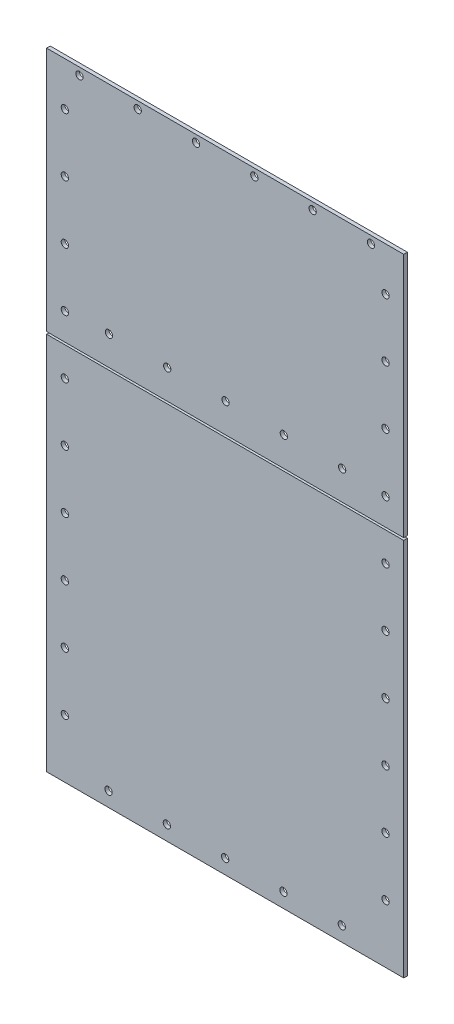
from build123d import *

# Parameters (mm, degrees)
SKETCH1_W             = 155.58
SKETCH1_H             = 106.95
SKETCH1_R             = 1.5875
BOSS_EXTRUDE1_DEPTH   = 1.5875
SKETCH1_H_2           = 165.1
BOSS_EXTRUDE1_2_DEPTH = 1.5875


with BuildPart() as part:
    # Sketch1 → Boss-Extrude1 (new body)
    with BuildSketch(Plane.XY):
        with Locations((77.79, -53.475)):
            Rectangle(SKETCH1_W, SKETCH1_H)
        with Locations((7.94, -95.25)):
            Circle(SKETCH1_R, mode=Mode.SUBTRACT)
        with Locations((7.94, -69.85)):
            Circle(SKETCH1_R, mode=Mode.SUBTRACT)
        with Locations((27.141, -94.25)):
            Circle(SKETCH1_R, mode=Mode.SUBTRACT)
        with Locations((52.541, -94.25)):
            Circle(SKETCH1_R, mode=Mode.SUBTRACT)
        with Locations((7.94, -44.45)):
            Circle(SKETCH1_R, mode=Mode.SUBTRACT)
        with Locations((7.94, -19.05)):
            Circle(SKETCH1_R, mode=Mode.SUBTRACT)
        with Locations((14.29, -3.175)):
            Circle(SKETCH1_R, mode=Mode.SUBTRACT)
        with Locations((39.69, -3.175)):
            Circle(SKETCH1_R, mode=Mode.SUBTRACT)
        with Locations((65.09, -3.175)):
            Circle(SKETCH1_R, mode=Mode.SUBTRACT)
        with Locations((77.941, -94.25)):
            Circle(SKETCH1_R, mode=Mode.SUBTRACT)
        with Locations((103.341, -94.25)):
            Circle(SKETCH1_R, mode=Mode.SUBTRACT)
        with Locations((128.741, -94.25)):
            Circle(SKETCH1_R, mode=Mode.SUBTRACT)
        with Locations((147.64, -95.25)):
            Circle(SKETCH1_R, mode=Mode.SUBTRACT)
        with Locations((147.64, -69.85)):
            Circle(SKETCH1_R, mode=Mode.SUBTRACT)
        with Locations((90.49, -3.175)):
            Circle(SKETCH1_R, mode=Mode.SUBTRACT)
        with Locations((115.89, -3.175)):
            Circle(SKETCH1_R, mode=Mode.SUBTRACT)
        with Locations((147.64, -44.45)):
            Circle(SKETCH1_R, mode=Mode.SUBTRACT)
        with Locations((147.64, -19.05)):
            Circle(SKETCH1_R, mode=Mode.SUBTRACT)
        with Locations((141.29, -3.175)):
            Circle(SKETCH1_R, mode=Mode.SUBTRACT)
    extrude(amount=BOSS_EXTRUDE1_DEPTH)


with BuildPart() as body_2:
    # Sketch1 → Boss-Extrude1 2 (new body)
    with BuildSketch(Plane.XY):
        with Locations((77.79, -190.5)):
            Rectangle(SKETCH1_W, SKETCH1_H_2)
        with Locations((7.94, -247.65)):
            Circle(SKETCH1_R, mode=Mode.SUBTRACT)
        with Locations((26.987, -266.7)):
            Circle(SKETCH1_R, mode=Mode.SUBTRACT)
        with Locations((7.94, -222.25)):
            Circle(SKETCH1_R, mode=Mode.SUBTRACT)
        with Locations((52.387, -266.7)):
            Circle(SKETCH1_R, mode=Mode.SUBTRACT)
        with Locations((77.787, -266.7)):
            Circle(SKETCH1_R, mode=Mode.SUBTRACT)
        with Locations((7.94, -196.85)):
            Circle(SKETCH1_R, mode=Mode.SUBTRACT)
        with Locations((7.94, -171.45)):
            Circle(SKETCH1_R, mode=Mode.SUBTRACT)
        with Locations((7.94, -146.05)):
            Circle(SKETCH1_R, mode=Mode.SUBTRACT)
        with Locations((103.187, -266.7)):
            Circle(SKETCH1_R, mode=Mode.SUBTRACT)
        with Locations((128.587, -266.7)):
            Circle(SKETCH1_R, mode=Mode.SUBTRACT)
        with Locations((147.64, -247.65)):
            Circle(SKETCH1_R, mode=Mode.SUBTRACT)
        with Locations((147.64, -222.25)):
            Circle(SKETCH1_R, mode=Mode.SUBTRACT)
        with Locations((147.64, -196.85)):
            Circle(SKETCH1_R, mode=Mode.SUBTRACT)
        with Locations((147.64, -171.45)):
            Circle(SKETCH1_R, mode=Mode.SUBTRACT)
        with Locations((147.64, -146.05)):
            Circle(SKETCH1_R, mode=Mode.SUBTRACT)
        with Locations((7.94, -120.65)):
            Circle(SKETCH1_R, mode=Mode.SUBTRACT)
        with Locations((147.64, -120.65)):
            Circle(SKETCH1_R, mode=Mode.SUBTRACT)
    extrude(amount=BOSS_EXTRUDE1_2_DEPTH)


solid = Compound([part.part, body_2.part])
